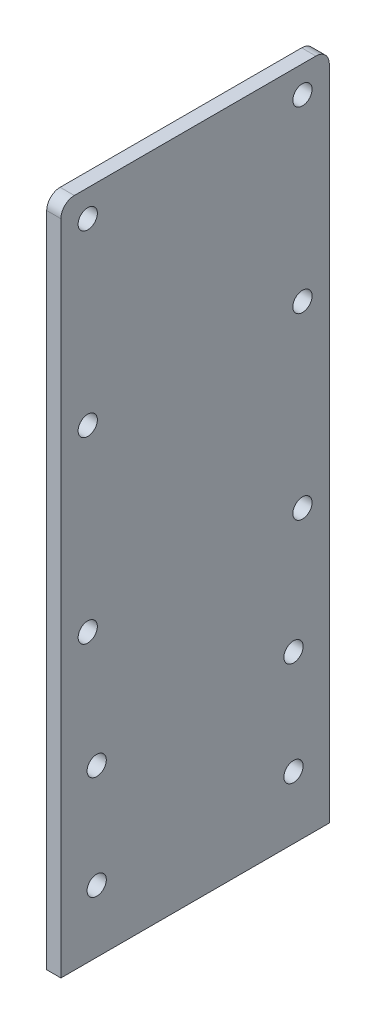
from build123d import *

# Parameters (mm, degrees)
SKETCH1_W           = 60
SKETCH1_H           = 150
SKETCH1_R           = 2.15
BOSS_EXTRUDE1_DEPTH = 3.175
FILLET1_R           = 3


with BuildPart() as part:
    # Sketch1 → Boss-Extrude1 (new body)
    with BuildSketch(Plane(origin=(0, 0, 0), x_dir=(0, 0, -1), z_dir=(1, 0, 0))):
        Rectangle(SKETCH1_W, SKETCH1_H)
        with Locations((-22, -61.025)):
            Circle(SKETCH1_R, mode=Mode.SUBTRACT)
        with Locations((22, -61.025)):
            Circle(SKETCH1_R, mode=Mode.SUBTRACT)
        with Locations((-22, -37.851)):
            Circle(SKETCH1_R, mode=Mode.SUBTRACT)
        with Locations((22, -37.851)):
            Circle(SKETCH1_R, mode=Mode.SUBTRACT)
        with Locations((-24, 69)):
            Circle(SKETCH1_R, mode=Mode.SUBTRACT)
        with Locations((-24, 29)):
            Circle(SKETCH1_R, mode=Mode.SUBTRACT)
        with Locations((-24, -11)):
            Circle(SKETCH1_R, mode=Mode.SUBTRACT)
        with Locations((24, -11)):
            Circle(SKETCH1_R, mode=Mode.SUBTRACT)
        with Locations((24, 29)):
            Circle(SKETCH1_R, mode=Mode.SUBTRACT)
        with Locations((24, 69)):
            Circle(SKETCH1_R, mode=Mode.SUBTRACT)
    extrude(amount=BOSS_EXTRUDE1_DEPTH)

    # Fillet1
    fillet1_edges = [part.edges().sort_by_distance(p)[0] for p in [
        (1.5875, 75, -30),
        (1.5875, 75, 30),
    ]]
    fillet(fillet1_edges, radius=FILLET1_R)


solid = part.part
